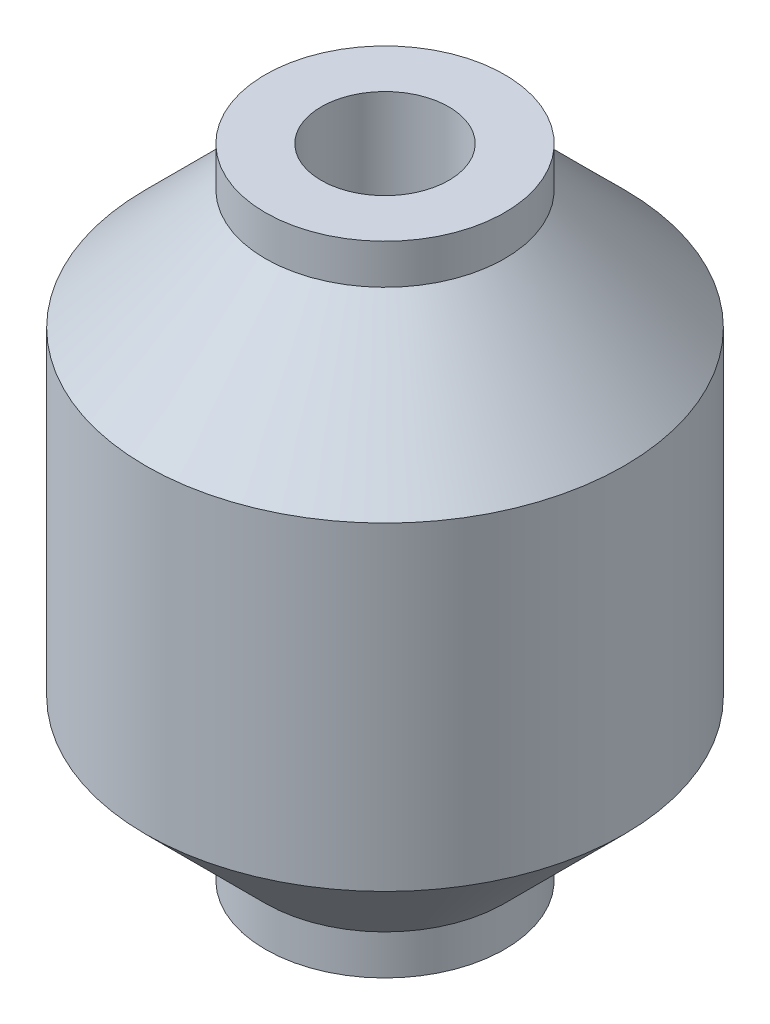
from build123d import *

# Parameters (mm, degrees)
SKETCH1_R           = 6
BOSS_EXTRUDE1_DEPTH = 4
SKETCH2_R           = 3
BOSS_EXTRUDE2_DEPTH = 4
SKETCH3_R           = 1.6
CUT_EXTRUDE1_DEPTH  = 16
CHAMFER1_SIZE       = 3


with BuildPart() as part:
    # Sketch1 → Boss-Extrude1 (new, symmetric)
    with BuildSketch(Plane(origin=(0, 0, 0), x_dir=(1, 0, 0), z_dir=(0, 1, 0))):
        with Locations(Location((0, 0, 0), (0, 0, 270))):
            Circle(SKETCH1_R)
    extrude(amount=BOSS_EXTRUDE1_DEPTH, both=True)

    # Sketch2 → Boss-Extrude2 (add)
    with BuildSketch(Plane(origin=(0, 4, 0), x_dir=(1, 0, 0), z_dir=(0, 1, 0))):
        with Locations(Location((0, 0, 0), (0, 0, 270))):
            Circle(SKETCH2_R)
    boss_extrude2 = extrude(amount=BOSS_EXTRUDE2_DEPTH)

    # Mirror1: Boss-Extrude2 across plane
    add(boss_extrude2.mirror(Plane.ZX))

    # Sketch3 → Cut-Extrude1 (cut)
    with BuildSketch(Plane(origin=(0, 8, 0), x_dir=(1, 0, 0), z_dir=(0, 1, 0))):
        with Locations(Location((0, 0, 0), (0, 0, 270))):
            Circle(SKETCH3_R)
    extrude(amount=-CUT_EXTRUDE1_DEPTH, mode=Mode.SUBTRACT)

    # Chamfer1
    chamfer1_edges = [part.edges().sort_by_distance(p)[0] for p in [
        (0, -4, -3),
        (0, 4, -3),
    ]]
    chamfer(chamfer1_edges, length=CHAMFER1_SIZE - 0.0001)  # a hair under: the kernel refuses the full size


solid = part.part
